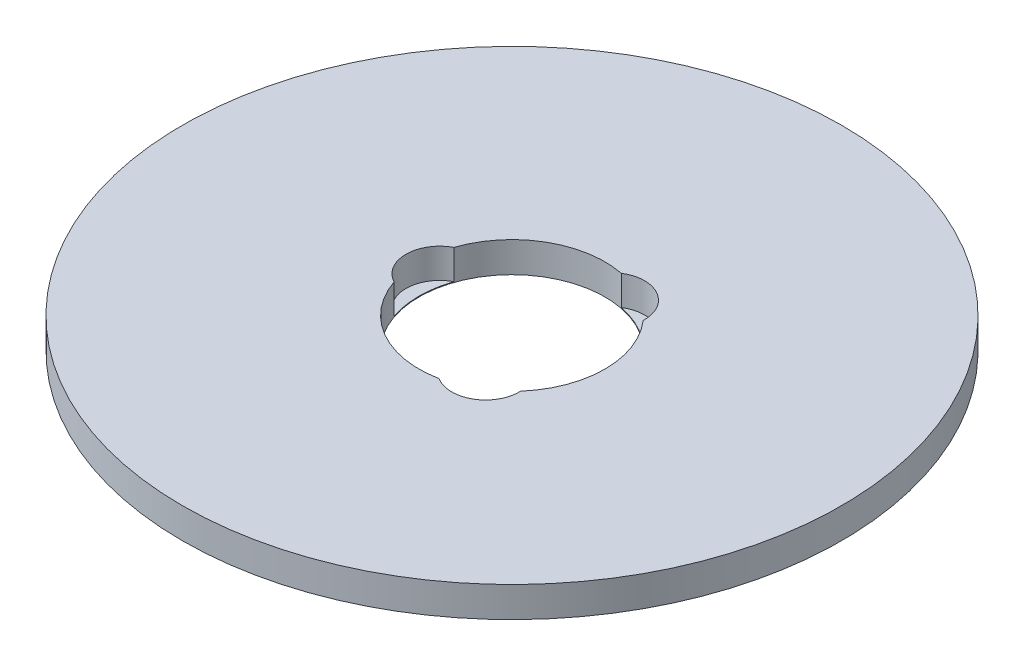
from build123d import *

# Parameters (mm, degrees)
SKETCH1_R           = 97.5
BOSS_EXTRUDE1_DEPTH = 9
SKETCH2_R           = 27.5
CUT_EXTRUDE1_DEPTH  = 139.179231435
SKETCH3_R           = 10
CUT_EXTRUDE2_DEPTH  = 8.785484988
CIRPATTERN1_COUNT   = 3


with BuildPart() as part:
    # Sketch1 → Boss-Extrude1 (new body)
    with BuildSketch(Plane(origin=(0, 0, 0), x_dir=(1, 0, 0), z_dir=(0, 1, 0))):
        Circle(SKETCH1_R)
    extrude(amount=BOSS_EXTRUDE1_DEPTH)

    # Sketch2 → Cut-Extrude1 (cut, through all)
    with BuildSketch(Plane(origin=(0, 0, 0), x_dir=(1, 0, 0), z_dir=(0, 1, 0))):
        Circle(SKETCH2_R)
    extrude(amount=CUT_EXTRUDE1_DEPTH, mode=Mode.SUBTRACT)

    # Sketch3 → Cut-Extrude2 (cut)
    with BuildSketch(Plane(origin=(0, 9, 0), x_dir=(1, 0, 0), z_dir=(0, 1, 0))):
        with Locations((-21.377340855, 0)):
            Circle(SKETCH3_R)
    cut_extrude2 = extrude(amount=-CUT_EXTRUDE2_DEPTH, mode=Mode.SUBTRACT)

    # CirPattern1: Cut-Extrude2 ×3 about axis
    cirpattern1_axis = Axis((0, 0, 0), (0, 1, 0))
    for i in range(1, CIRPATTERN1_COUNT):
        add(cut_extrude2.rotate(cirpattern1_axis, i * 360 / CIRPATTERN1_COUNT), mode=Mode.SUBTRACT)


solid = part.part
